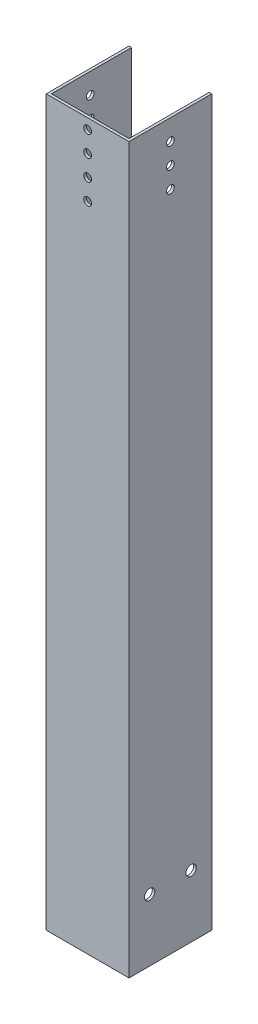
from build123d import *

# Parameters (mm, degrees)
BOSS_EXTRUDE1_DEPTH = 444.5
SKETCH2_R           = 3.175
SKETCH2_R_2         = 2.38125
CUT_EXTRUDE1_DEPTH  = 451.268286691
SKETCH3_R           = 2.38125
CUT_EXTRUDE2_DEPTH  = 451.268286691


with BuildPart() as part:
    # Sketch1 → Boss-Extrude1 (new body)
    with BuildSketch(Plane(origin=(0, 0, 0), x_dir=(1, 0, 0), z_dir=(0, 1, 0))):
        Polygon((0, 0), (50.8, 0), (50.8, 50.8), (49.2125, 50.8), (49.2125, 1.5875), (1.5875, 1.5875), (1.5875, 50.8), (0, 50.8), align=None)
    extrude(amount=BOSS_EXTRUDE1_DEPTH)

    # Sketch2 → Cut-Extrude1 (cut, through all)
    with BuildSketch(Plane(origin=(50.8, 0, 0), x_dir=(0, 0, -1), z_dir=(1, 0, 0))):
        with Locations((12.7, 38.1)):
            Circle(SKETCH2_R)
        with Locations((38.1, 38.1)):
            Circle(SKETCH2_R)
        with Locations((25.4, 406.4)):
            Circle(SKETCH2_R_2)
        with Locations((25.4, 419.1)):
            Circle(SKETCH2_R_2)
        with Locations((25.4, 431.8)):
            Circle(SKETCH2_R_2)
    extrude(amount=-CUT_EXTRUDE1_DEPTH, mode=Mode.SUBTRACT)

    # Sketch3 → Cut-Extrude2 (cut, through all)
    with BuildSketch(Plane.XY):
        with Locations((25.4, 438.15)):
            Circle(SKETCH3_R)
        with Locations((25.4, 425.45)):
            Circle(SKETCH3_R)
        with Locations((25.4, 412.75)):
            Circle(SKETCH3_R)
        with Locations((25.4, 400.05)):
            Circle(SKETCH3_R)
    extrude(amount=-CUT_EXTRUDE2_DEPTH, mode=Mode.SUBTRACT)


solid = part.part
